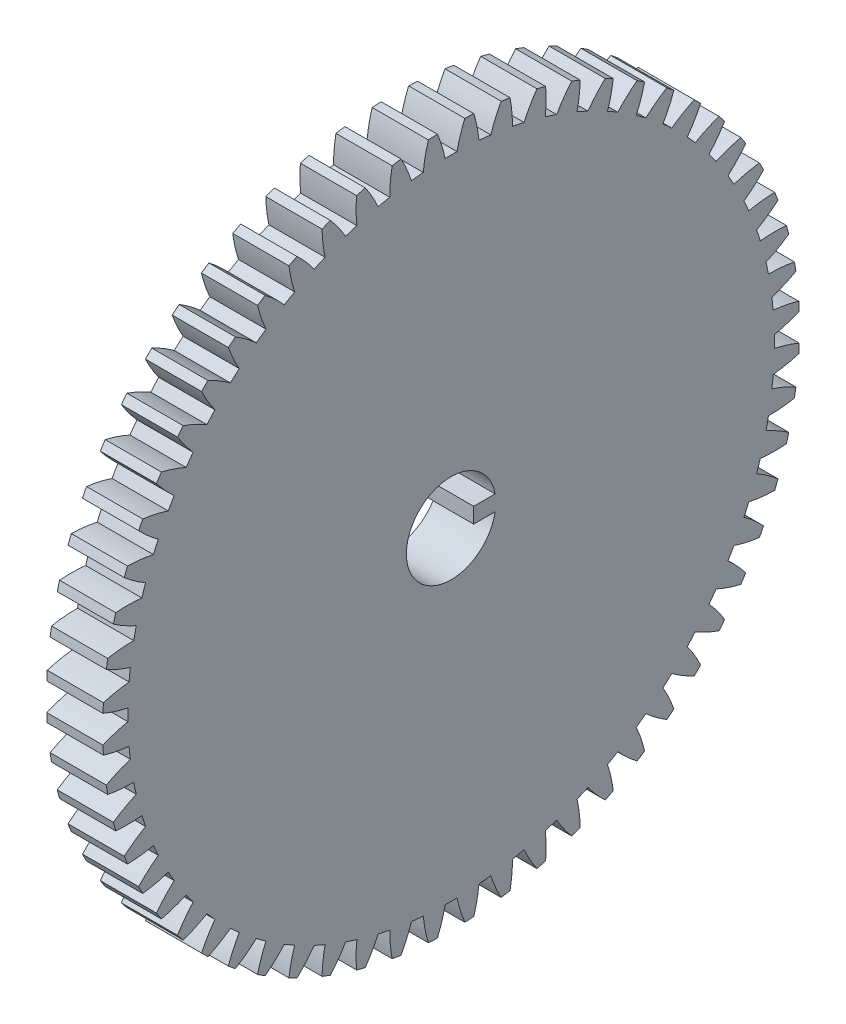
from build123d import *

# Parameters (mm, degrees)
BASPROSKE_W         = 6.35
BASPROSKE_H         = 39.37
TOOTHCUT_DEPTH      = 57.038525141
TEETHCUTS_COUNT     = 60
TEETHCUTS_ANGLE     = 354
BORSKE_R            = 5.05
BORE_DEPTH          = 50.8000508
BOSS_EXTRUDE1_DEPTH = 6.35


with BuildPart() as part:
    # BasProSke → Base-Revolve (revolve)
    with BuildSketch(Plane(origin=(0, 0, 0), x_dir=(1, 0, 0), z_dir=(0, 1, 0))):
        with Locations((3.175, 19.685)):
            Rectangle(BASPROSKE_W, BASPROSKE_H)
    revolve(axis=Axis((-10, 0, 0), (1, 0, 0)))

    # TooCutSke → ToothCut (cut, through all)
    with BuildSketch(Plane(origin=(0, 0, 0), x_dir=(0, 0, -1), z_dir=(1, 0, 0))):
        with BuildLine():
            ThreePointArc((0.674018167, 36.51898047), (0, 36.5252), (-0.674018167, 36.51898047))
            ThreePointArc((-0.674018167, 36.51898047), (-1.047934425, 37.963458687), (-1.561312288, 39.364449))
            ThreePointArc((-1.561312288, 39.364449), (0, 39.3954), (1.561312288, 39.364449))
            ThreePointArc((1.561312288, 39.364449), (1.047934425, 37.963458687), (0.674018167, 36.51898047))
        make_face()
    toothcut = extrude(amount=TOOTHCUT_DEPTH, mode=Mode.SUBTRACT)

    # TeethCuts: ToothCut ×60 about axis
    teethcuts_axis = Axis((-10, 0, 0), (1, 0, 0))
    for i in range(1, TEETHCUTS_COUNT):
        add(toothcut.rotate(teethcuts_axis, i * TEETHCUTS_ANGLE / (TEETHCUTS_COUNT - 1)), mode=Mode.SUBTRACT)

    # BorSke → Bore (cut, symmetric)
    with BuildSketch(Plane(origin=(0, 0, 0), x_dir=(0, 0, -1), z_dir=(1, 0, 0))):
        Circle(BORSKE_R)
    extrude(amount=BORE_DEPTH, both=True, mode=Mode.SUBTRACT)

    # Sketch1 → Boss-Extrude1 (add)
    with BuildSketch(Plane(origin=(6.35, 0, 0), x_dir=(0, 0, -1), z_dir=(1, 0, 0))):
        with BuildLine():
            ThreePointArc((4.973617898, -0.875), (5.05, 0), (4.973617898, 0.875))
            Line((4.973617898, 0.875), (2.55, 0.875))
            Line((2.55, 0.875), (2.55, -0.875))
            Line((2.55, -0.875), (4.973617898, -0.875))
        make_face()
    extrude(amount=-BOSS_EXTRUDE1_DEPTH)


solid = part.part
